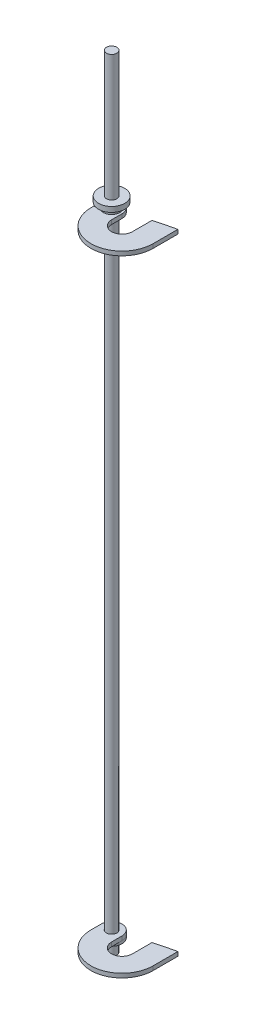
from build123d import *

# Parameters (mm, degrees)
SKETCH1_R              = 3.175
BOSS_EXTRUDE1_DEPTH    = 236.855
SKETCH2_R              = 3.175
BOSS_EXTRUDE2_DEPTH    = 2.54
FILLET1_R              = 1
SKETCH3_R              = 6.35
SKETCH3_R_2            = 3.175
BOSS_EXTRUDE3_DEPTH    = 1.651
SKETCH4_R              = 3.175
BOSS_EXTRUDE4_DEPTH    = 2.54
CUT_EXTRUDE1_DEPTH     = 19.05
MOVE_START             = -230.124
MOVE_FACE1_OUTLINE_R   = 3.2385
MOVE_FACE1_OUTLINE_R_2 = 3.175
MOVE_FACE1_DEPTH       = 2.54
SKETCH7_R              = 5.08
SKETCH7_R_2            = 2.38125
BOSS_EXTRUDE6_DEPTH    = 3.175
SKETCH8_R              = 8
SKETCH8_R_2            = 2.38125
BOSS_EXTRUDE7_DEPTH    = 3.175
SKETCH9_R              = 0.635
CUT_EXTRUDE2_DEPTH     = 5.08
MOVE_FACE2_BY          = 2.54
MOVE_FACE2_2_BY        = 2.54


# Read off the part's stored shape, not the designer's step: Move Face1
with BuildPart() as part:
    # Sketch1 → Boss-Extrude1 (new, symmetric)
    with BuildSketch(Plane(origin=(0, 0, 0), x_dir=(1, 0, 0), z_dir=(0, 1, 0))):
        with Locations(Location((0, 0, 0), (0, 0, 270))):
            Circle(SKETCH1_R)
    extrude(amount=BOSS_EXTRUDE1_DEPTH, both=True)

    # Move Face2: a face moved outward by 2.54
    extrude(part.faces().sort_by_distance((0, -236.855, 0))[0], amount=MOVE_FACE2_BY, dir=(0, -1, 0))

    # Move Face2 2: a face moved outward by 2.54
    extrude(part.faces().sort_by_distance((0, 236.855, 0))[0], amount=MOVE_FACE2_2_BY, dir=(0, 1, 0))


with BuildPart() as body_2:
    # Sketch2 → Boss-Extrude2 (new body)
    with BuildSketch(Plane(origin=(0, 236.855, 0), x_dir=(1, 0, 0), z_dir=(0, 1, 0))):
        Polygon((3.767272711, 2.609398093), (-0.376168682, 4.567252917), (-4.143441392, 1.957854824), (-3.767272711, -2.609398093), (0.376168682, -4.567252917), (4.143441392, -1.957854824), align=None)
        with Locations(Location((0, 0, 0), (0, 0, 270))):
            Circle(SKETCH2_R, mode=Mode.SUBTRACT)
    extrude(amount=-BOSS_EXTRUDE2_DEPTH)

    # Fillet1
    # the kernel refuses this fillet: 1 mm, written as the material it takes off along each edge
    with BuildSketch(Plane(origin=(-1.678983362, 236.855, 5.990752153), x_dir=(0, -1, 0), z_dir=(0.8220608177173138, 0, -0.5693996943922096)), Plane(origin=(-6.027635233, 236.855, 1.541333832), x_dir=(0, -1, 0), z_dir=(0.9041450091094061, 0, 0.4272257044028978)), Plane(origin=(-4.348651871, 236.855, -4.449418321), x_dir=(0, -1, 0), z_dir=(0.0820841913920923, 0, 0.9966253987951073)), Plane(origin=(1.678983362, 236.855, -5.990752153), x_dir=(0, -1, 0), z_dir=(-0.8220608177173137, 0, 0.5693996943922096)), Plane(origin=(6.027635233, 236.855, -1.541333832), x_dir=(0, -1, 0), z_dir=(-0.904145009109406, 0, -0.427225704402898)), Plane(origin=(4.348651871, 236.855, 4.449418321), x_dir=(0, -1, 0), z_dir=(-0.08208419139209193, 0, -0.9966253987951073))) as fillet1_piece_1:
        with BuildLine():
            CenterArc((FILLET1_R, FILLET1_R), FILLET1_R, 180, 90)
            Line((0, FILLET1_R), (0, 0))
            Line((0, 0), (FILLET1_R, 0))
        make_face()
    extrude(amount=9.582717762, mode=Mode.SUBTRACT)


with BuildPart() as body_3:
    # Mirror1: mirrored copy
    add(body_2.part.mirror(Plane.ZX))


with BuildPart() as body_4:
    # Sketch3 → Boss-Extrude3 (new body)
    with BuildSketch(Plane(origin=(0, -231.775, 0), x_dir=(1, 0, 0), z_dir=(0, 1, 0))):
        with Locations(Location((0, 0, 0), (0, 0, 90))):
            Circle(SKETCH3_R)
        with Locations(Location((0, 0, 0), (0, 0, 90))):
            Circle(SKETCH3_R_2, mode=Mode.SUBTRACT)
    extrude(amount=BOSS_EXTRUDE3_DEPTH)


with BuildPart() as body_5:
    # Sketch4 → Boss-Extrude4 (new body)
    with BuildSketch(Plane(origin=(0, -230.124, 0), x_dir=(1, 0, 0), z_dir=(0, 1, 0))):
        with BuildLine():
            Line((6.35, 0), (6.35, -6.35))
            ThreePointArc((6.35, -6.35), (12.7, -12.7), (19.05, -6.35))
            Line((19.05, -6.35), (19.05, 13.900226486))
            Line((19.05, 13.900226486), (31.75, 13.900226486))
            Line((31.75, 13.900226486), (31.75, -6.35))
            ThreePointArc((31.75, -6.35), (12.7, -25.4), (-6.35, -6.35))
            Line((-6.35, -6.35), (-6.35, 0))
            ThreePointArc((-6.35, 0), (0, 6.35), (6.35, 0))
        make_face()
        with Locations(Location((0, 0, 0), (0, 0, 270))):
            Circle(SKETCH4_R, mode=Mode.SUBTRACT)
    extrude(amount=BOSS_EXTRUDE4_DEPTH)

    # Sketch5 → Cut-Extrude1 (cut)
    with BuildSketch(Plane.XZ.offset(230.124)):
        with BuildLine():
            Line((19.05, -5.644264501), (19.05, -13.900226486))
            Line((19.05, -13.900226486), (31.75, -13.900226486))
            Line((31.75, -13.900226486), (31.75, -8.851150591))
            ThreePointArc((31.75, -8.851150591), (25.378745016, -7.331882129), (19.05, -5.644264501))
        make_face()
    extrude(amount=-CUT_EXTRUDE1_DEPTH, mode=Mode.SUBTRACT)

    # Move Face1 outline → Move Face1 (cut)
    with BuildSketch(Plane(origin=(0, 0, 0), x_dir=(1, 0, 0), z_dir=(0, 1, 0)).offset(MOVE_START)):
        Circle(MOVE_FACE1_OUTLINE_R)
        Circle(MOVE_FACE1_OUTLINE_R_2, mode=Mode.SUBTRACT)
    extrude(amount=MOVE_FACE1_DEPTH, mode=Mode.SUBTRACT)


with BuildPart() as body_6:
    # Body-Move/Copy1: copy of body 5
    add(body_5.part.moved(Location((0, 383.3495, 0))))

    # Sketch9 → Cut-Extrude2 (cut)
    with BuildSketch(Plane(origin=(0, 155.7655, 0), x_dir=(1, 0, 0), z_dir=(0, 1, 0))):
        with Locations(Location((0, -4.269670425, 0), (0, 0, 270))):
            Circle(SKETCH9_R)
        with BuildLine():
            Line((-7.696390017, -3.286590368), (-5.777668953, -3.286590368))
            ThreePointArc((-5.777668953, -3.286590368), (-5.142668953, -3.921590368), (-5.777668953, -4.556590368))
            Line((-5.777668953, -4.556590368), (-7.696390017, -4.556590368))
            ThreePointArc((-7.696390017, -4.556590368), (-8.331390017, -3.921590368), (-7.696390017, -3.286590368))
        make_face()
    extrude(amount=-CUT_EXTRUDE2_DEPTH, mode=Mode.SUBTRACT)


with BuildPart() as body_7:
    # Sketch7 → Boss-Extrude6 (new body)
    with BuildSketch(Plane(origin=(0, 155.7655, 0), x_dir=(1, 0, 0), z_dir=(0, 1, 0))):
        with Locations(Location((0, 0, 0), (0, 0, 270))):
            Circle(SKETCH7_R)
        with Locations(Location((0, 0, 0), (0, 0, 270))):
            Circle(SKETCH7_R_2, mode=Mode.SUBTRACT)
    extrude(amount=BOSS_EXTRUDE6_DEPTH)

    # Sketch8 → Boss-Extrude7 (add)
    with BuildSketch(Plane(origin=(0, 158.9405, 0), x_dir=(1, 0, 0), z_dir=(0, 1, 0))):
        with Locations(Location((0, 0, 0), (0, 0, 270))):
            Circle(SKETCH8_R)
        with Locations(Location((0, 0, 0), (0, 0, 270))):
            Circle(SKETCH8_R_2, mode=Mode.SUBTRACT)
    extrude(amount=BOSS_EXTRUDE7_DEPTH)


solid = Compound([part.part, body_4.part, body_5.part, body_6.part, body_7.part])
